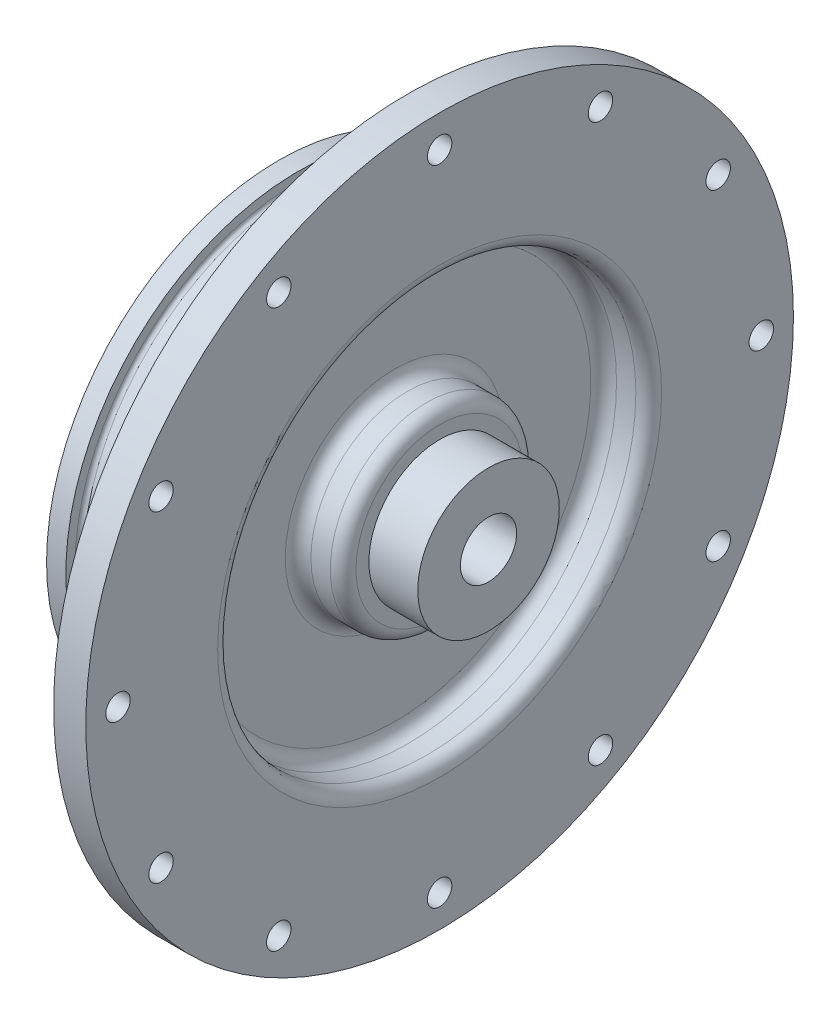
from build123d import *

# Parameters (mm, degrees)
SKETCH1_R               = 69.85
BOSS_EXTRUDE1_DEPTH     = 6.35
SKETCH2_R               = 45.847
BOSS_EXTRUDE2_DEPTH     = 25.4
SKETCH11_R              = 1.89865
CUT_EXTRUDE3_DEPTH      = 10.16
CIRPATTERN1_COUNT       = 12
CUT_EXTRUDE4_DEPTH      = 104.759854984
CUT_EXTRUDE4_DEPTH_BACK = 104.759854984
SKETCH15_R              = 5.55625
BOSS_EXTRUDE3_START     = 9.652
SKETCH17_R              = 13.97
SKETCH17_R_2            = 5.55625
BOSS_EXTRUDE3_DEPTH     = 9.652
SKETCH18_W              = 8.89
SKETCH18_H              = 22.225
FILLET1_R               = 2.54
SKETCH19_R              = 2.413
CUT_EXTRUDE5_DEPTH      = 104.759854954


with BuildPart() as part:
    # Sketch1 → Boss-Extrude1 (new body)
    with BuildSketch(Plane(origin=(0, 0, 0), x_dir=(0, 0, -1), z_dir=(1, 0, 0))):
        Circle(SKETCH1_R)
    extrude(amount=BOSS_EXTRUDE1_DEPTH)

    # Sketch2 → Boss-Extrude2 (add)
    with BuildSketch(Plane.ZY):
        Circle(SKETCH2_R)
    extrude(amount=BOSS_EXTRUDE2_DEPTH)

    # Sketch11 → Cut-Extrude3 (cut)
    with BuildSketch(Plane(origin=(0, 0, -45.847), x_dir=(-1, 0, 0), z_dir=(0, 0, -1))):
        with Locations((7.62, 0)):
            Circle(SKETCH11_R)
    cut_extrude3 = extrude(amount=-CUT_EXTRUDE3_DEPTH, mode=Mode.SUBTRACT)

    # CirPattern1: Cut-Extrude3 ×12 about axis
    cirpattern1_axis = Axis((0, 0, 0), (-1, 0, 0))
    for i in range(1, CIRPATTERN1_COUNT):
        add(cut_extrude3.rotate(cirpattern1_axis, i * 360 / CIRPATTERN1_COUNT), mode=Mode.SUBTRACT)

    # Sketch15 → Cut-Extrude4 (cut, two sides: drawn at the far end of the back side and taken through both)
    with BuildSketch(Plane(origin=(6.35, 0, 0), x_dir=(0, 0, -1), z_dir=(1, 0, 0)).offset(-CUT_EXTRUDE4_DEPTH_BACK)):
        Circle(SKETCH15_R)
    extrude(amount=CUT_EXTRUDE4_DEPTH + CUT_EXTRUDE4_DEPTH_BACK, mode=Mode.SUBTRACT)

    # Sketch16 → Cut-Revolve1 (revolve, cut)
    with BuildSketch(Plane.XY):
        with BuildLine():
            Line((-21.59, 45.847), (-14.4018, 45.847))
            Line((-14.4018, 45.847), (-14.4018, 44.069))
            ThreePointArc((-14.4018, 44.069), (-14.624984633, 43.530184633), (-15.1638, 43.307))
            Line((-15.1638, 43.307), (-20.828, 43.307))
            ThreePointArc((-20.828, 43.307), (-21.366815367, 43.530184633), (-21.59, 44.069))
            Line((-21.59, 44.069), (-21.59, 45.847))
        make_face()
    revolve(axis=Axis((0, 0, 0), (-1, 0, 0)), mode=Mode.SUBTRACT)

    # Sketch17 → Boss-Extrude3 (add)
    with BuildSketch(Plane(origin=(6.35, 0, 0), x_dir=(0, 0, -1), z_dir=(1, 0, 0)).offset(BOSS_EXTRUDE3_START)):
        Circle(SKETCH17_R)
        Circle(SKETCH17_R_2, mode=Mode.SUBTRACT)
    extrude(amount=-BOSS_EXTRUDE3_DEPTH)

    # Sketch18 → Cut-Revolve2 (revolve, cut)
    with BuildSketch(Plane.XY):
        with Locations((1.905, 30.1625)):
            Rectangle(SKETCH18_W, SKETCH18_H)
    revolve(axis=Axis((0, 0, 0), (-1, 0, 0)), mode=Mode.SUBTRACT)

    # Fillet1
    fillet1_edges = [part.edges().sort_by_distance(p)[0] for p in [
        (6.35, -41.275, 0),
        (-2.54, -41.275, 0),
        (-2.54, -19.05, 0),
        (6.35, -19.05, 0),
    ]]
    fillet(fillet1_edges, radius=FILLET1_R)

    # Sketch19 → Cut-Extrude5 (cut, through all)
    with BuildSketch(Plane(origin=(6.35, 0, 0), x_dir=(0, 0, -1), z_dir=(1, 0, 0))):
        with Locations((0, 63.5)):
            Circle(SKETCH19_R)
        with Locations((31.75, 54.99261314)):
            Circle(SKETCH19_R)
        with Locations((54.99261314, 31.75)):
            Circle(SKETCH19_R)
        with Locations((63.5, 0)):
            Circle(SKETCH19_R)
        with Locations((54.99261314, -31.75)):
            Circle(SKETCH19_R)
        with Locations((31.75, -54.99261314)):
            Circle(SKETCH19_R)
        with Locations((0, -63.5)):
            Circle(SKETCH19_R)
        with Locations((-31.75, -54.99261314)):
            Circle(SKETCH19_R)
        with Locations((-54.99261314, -31.75)):
            Circle(SKETCH19_R)
        with Locations((-63.5, 0)):
            Circle(SKETCH19_R)
        with Locations((-54.99261314, 31.75)):
            Circle(SKETCH19_R)
        with Locations((-31.75, 54.99261314)):
            Circle(SKETCH19_R)
    extrude(amount=-CUT_EXTRUDE5_DEPTH, mode=Mode.SUBTRACT)


solid = part.part
